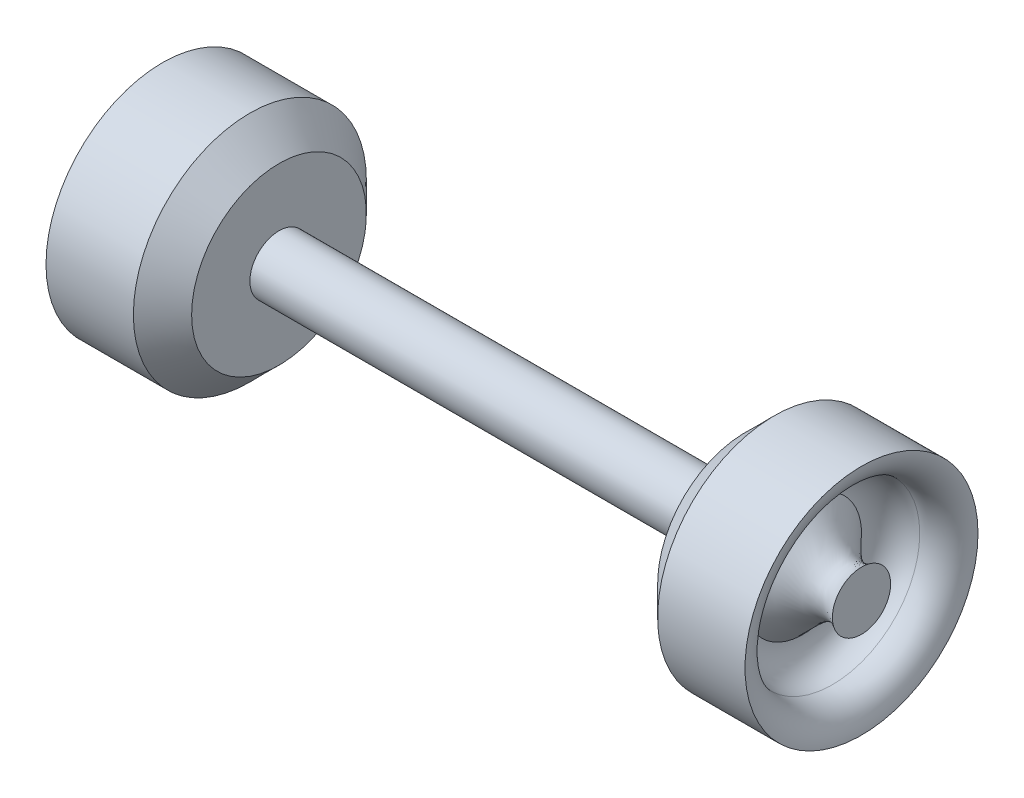
from build123d import *

# Parameters (mm, degrees)
SKETCH1_R           = 2.5
BOSS_EXTRUDE1_DEPTH = 20
SKETCH2_R           = 10
BOSS_EXTRUDE2_DEPTH = 10
SKETCH3_R           = 7.5
CUT_EXTRUDE1_DEPTH  = 5
FILLET1_R           = 2.5
FILLET2_R           = 2.5
CHAMFER1_SIZE       = 2.5


with BuildPart() as part:
    # Sketch1 → Boss-Extrude1 (new body)
    with BuildSketch(Plane(origin=(0, 0, 0), x_dir=(0, 0, -1), z_dir=(1, 0, 0))):
        Circle(SKETCH1_R)
    boss_extrude1 = extrude(amount=BOSS_EXTRUDE1_DEPTH)

    # Sketch2 → Boss-Extrude2 (add)
    with BuildSketch(Plane(origin=(20, 0, 0), x_dir=(0, 0, -1), z_dir=(1, 0, 0))):
        Circle(SKETCH2_R)
    boss_extrude2 = extrude(amount=BOSS_EXTRUDE2_DEPTH)

    # Sketch3 → Cut-Extrude1 (cut)
    with BuildSketch(Plane(origin=(30, 0, 0), x_dir=(0, 0, -1), z_dir=(1, 0, 0))):
        Circle(SKETCH3_R)
    cut_extrude1 = extrude(amount=-CUT_EXTRUDE1_DEPTH, mode=Mode.SUBTRACT)

    # Loft1: read off the stored shape, not the designer's step
    # Loft1: loft between two sections, ruled curve by curve
    loft1_from = [
        Edge.make_bspline([(30, 2.339164852, 0.882217543), (30, 4.103599939, -3.796112162), (30, -0.574729766, -5.560547248), (30, -2.339164852, -0.882217543), (30, -4.103599939, 3.796112162), (30, 0.574729766, 5.560547248), (30, 2.339164852, 0.882217543)], [0, 0, 0, 0, 0.5, 0.5, 0.5, 1, 1, 1, 1], 3, [1, 0.333333333, 0.333333333, 1, 0.333333333, 0.333333333, 1]),
    ]
    loft1_to = [
        Edge.make_bspline([(25, 0.918384281, -4.914933399), (25, -8.911482517, -6.75170196), (25, -10.748251078, 3.078164838), (25, -0.918384281, 4.914933399), (25, 8.911482517, 6.75170196), (25, 10.748251078, -3.078164838), (25, 0.918384281, -4.914933399)], [0, 0, 0, 0, 0.5, 0.5, 0.5, 1, 1, 1, 1], 3, [1, 0.333333333, 0.333333333, 1, 0.333333333, 0.333333333, 1]),
    ]
    loft1 = Solid(Shell([*[Face.make_surface_from_curves(loft1_from[k], loft1_to[k]) for k in range(1)], Face(Wire(loft1_from)), Face(Wire(loft1_to))]))
    add(loft1)

    # Mirror1: Boss-Extrude1, Boss-Extrude2, Cut-Extrude1, Loft1 across plane
    add(boss_extrude1.mirror(Plane(origin=(0, 0, 0), x_dir=(0, 0, 1), z_dir=(1, 0, 0))))
    add(boss_extrude2.mirror(Plane(origin=(0, 0, 0), x_dir=(0, 0, 1), z_dir=(1, 0, 0))))
    add(cut_extrude1.mirror(Plane(origin=(0, 0, 0), x_dir=(0, 0, 1), z_dir=(1, 0, 0))), mode=Mode.SUBTRACT)
    add(loft1.mirror(Plane(origin=(0, 0, 0), x_dir=(0, 0, 1), z_dir=(1, 0, 0))))

    # Fillet1
    fillet1_edges = [part.edges().sort_by_distance(p)[0] for p in [
        (25, 0, 7.5),
        (30, 0, 7.5),
    ]]
    fillet(fillet1_edges, radius=FILLET1_R - 0.0001)  # a hair under: the kernel refuses the full size

    # Fillet2
    fillet2_edges = [part.edges().sort_by_distance(p)[0] for p in [
        (-30, 0, 7.5),
        (-25, 0, 7.5),
    ]]
    fillet(fillet2_edges, radius=FILLET2_R - 0.0001)  # a hair under: the kernel refuses the full size

    # Chamfer1
    chamfer1_edges = [part.edges().sort_by_distance(p)[0] for p in [
        (-20, 0, 10),
        (20, 0, 10),
    ]]
    chamfer(chamfer1_edges, length=CHAMFER1_SIZE)


solid = part.part
